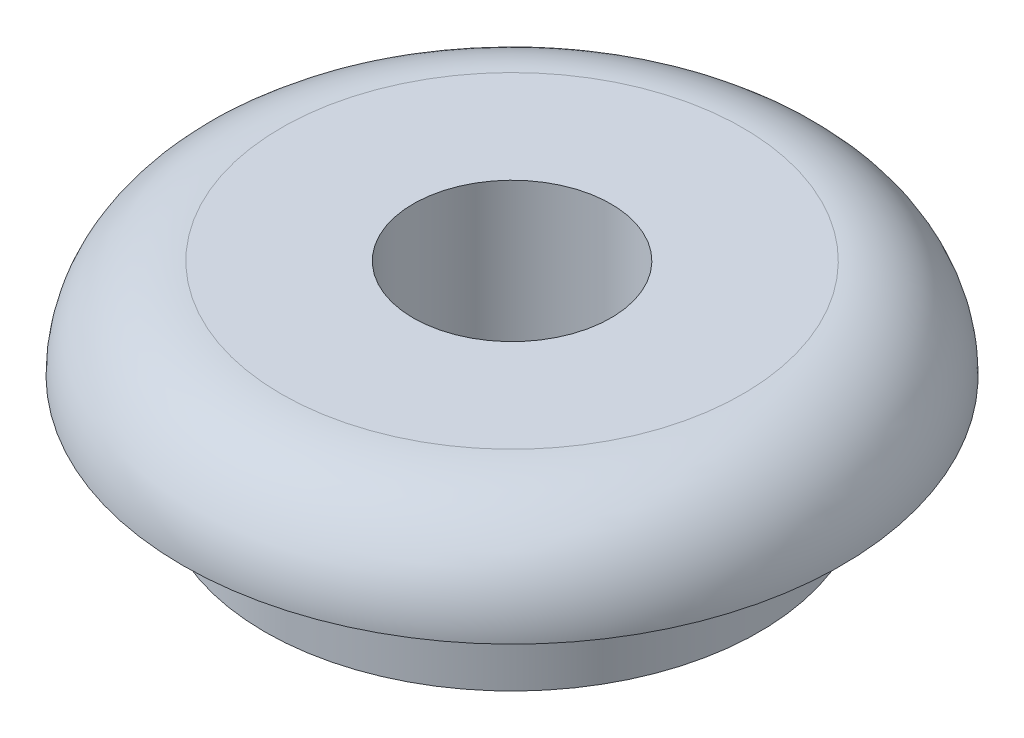
from build123d import *

# Parameters (mm, degrees)
SKETCH1_R           = 7.5
BOSS_EXTRUDE1_DEPTH = 6
BOSS_EXTRUDE2_START = -3
SKETCH2_R           = 10
SKETCH2_R_2         = 7.5
BOSS_EXTRUDE2_DEPTH = 3
FILLET1_R           = 3
SKETCH3_R           = 3
CUT_EXTRUDE1_DEPTH  = 16.362291496


with BuildPart() as part:
    # Sketch1 → Boss-Extrude1 (new body)
    with BuildSketch(Plane(origin=(0, 0, 0), x_dir=(1, 0, 0), z_dir=(0, 1, 0))):
        with Locations(Location((0, 0, 0), (0, 0, 270))):
            Circle(SKETCH1_R)
    extrude(amount=BOSS_EXTRUDE1_DEPTH)

    # Sketch2 → Boss-Extrude2 (add)
    with BuildSketch(Plane(origin=(0, 6, 0), x_dir=(1, 0, 0), z_dir=(0, 1, 0)).offset(BOSS_EXTRUDE2_START)):
        with Locations(Location((0, 0, 0), (0, 0, 270))):
            Circle(SKETCH2_R)
        with Locations(Location((0, 0, 0), (0, 0, 270))):
            Circle(SKETCH2_R_2, mode=Mode.SUBTRACT)
    extrude(amount=BOSS_EXTRUDE2_DEPTH)

    # Fillet1
    fillet1_edges = [part.edges().sort_by_distance(p)[0] for p in [
        (0, 6, -10),
    ]]
    fillet(fillet1_edges, radius=FILLET1_R - 0.0001)  # a hair under: the kernel refuses the full size

    # Sketch3 → Cut-Extrude1 (cut, through all)
    with BuildSketch(Plane(origin=(0, 6, 0), x_dir=(1, 0, 0), z_dir=(0, 1, 0))):
        with Locations(Location((0, 0, 0), (0, 0, 270))):
            Circle(SKETCH3_R)
    extrude(amount=-CUT_EXTRUDE1_DEPTH, mode=Mode.SUBTRACT)


solid = part.part
